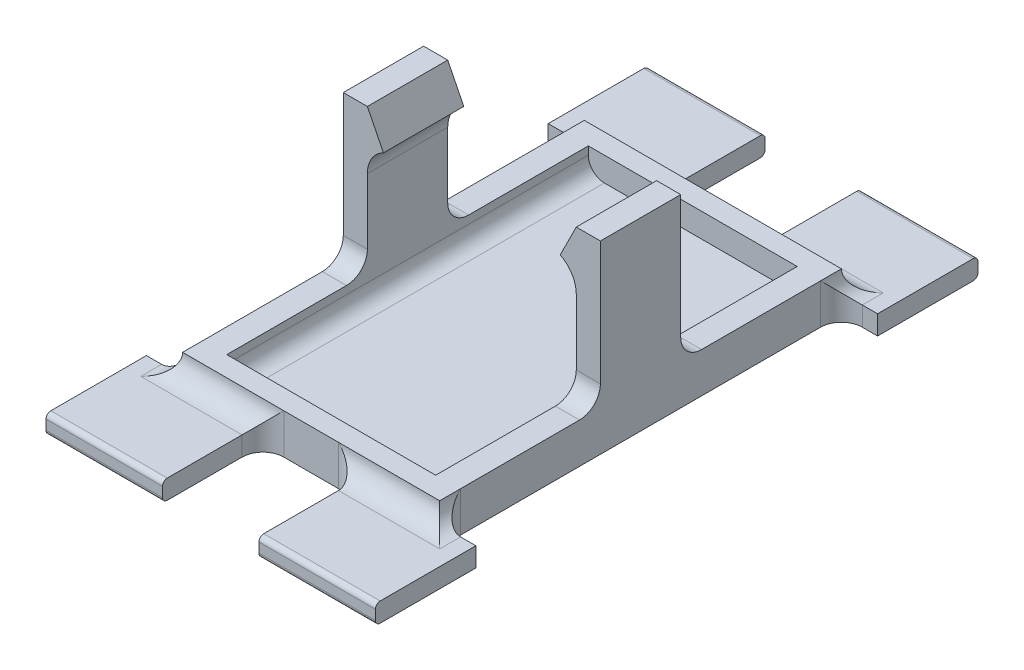
from build123d import *

# Parameters (mm, degrees)
SKETCH1_W                = 32
SKETCH1_H                = 50
BOSS_EXTRUDE1_DEPTH      = 5
CUT_EXTRUDE1_DEPTH       = 22.5
BOSS_EXTRUDE2_DEPTH      = 5
BOSS_EXTRUDE3_DEPTH      = 10
BOSS_EXTRUDE3_DEPTH_BACK = 4.5
BOSS_EXTRUDE3_START      = -16
BOSS_EXTRUDE4_START      = 6
BOSS_EXTRUDE4_DEPTH      = 14.5
FILLET1_R                = 2.6
FILLET2_R                = 2.6


with BuildPart() as part:
    # Sketch1 → Boss-Extrude1 (new body)
    with BuildSketch(Plane(origin=(0, 0, 0), x_dir=(1, 0, 0), z_dir=(0, 1, 0))):
        Rectangle(SKETCH1_W, SKETCH1_H)
    extrude(amount=BOSS_EXTRUDE1_DEPTH)

    # Sketch2 → Cut-Extrude1 (cut, symmetric)
    with BuildSketch(Plane.XY):
        with BuildLine():
            Line((-11, 2), (11, 2))
            ThreePointArc((11, 2), (12.414213562, 2.585786438), (13, 4))
            Line((13, 4), (13, 5))
            Line((13, 5), (-13, 5))
            Line((-13, 5), (-13, 4))
            ThreePointArc((-13, 4), (-12.414213562, 2.585786438), (-11, 2))
        make_face()
    extrude(amount=CUT_EXTRUDE1_DEPTH, both=True, mode=Mode.SUBTRACT)

    # Sketch3 → Boss-Extrude2 (add, symmetric)
    with BuildSketch(Plane.XY):
        with BuildLine():
            Line((-16, 5), (-16, 23))
            Line((-16, 23), (-13, 23))
            Line((-13, 23), (-11, 19))
            ThreePointArc((-11, 19), (-12.459649548, 17.666045055), (-13, 15.763932023))
            Line((-13, 15.763932023), (-13, 5))
            Line((-13, 5), (-16, 5))
        make_face()
        with BuildLine():
            Line((16, 5), (13, 5))
            Line((13, 5), (13, 15.763932023))
            ThreePointArc((13, 15.763932023), (12.459649548, 17.666045055), (11, 19))
            Line((11, 19), (13, 23))
            Line((13, 23), (16, 23))
            Line((16, 23), (16, 5))
        make_face()
    extrude(amount=BOSS_EXTRUDE2_DEPTH, both=True)

    # Sketch4 → Boss-Extrude3 (add, two sides: drawn at the far end of the back side and taken through both)
    with BuildSketch(Plane(origin=(0, 0, 0), x_dir=(0, 0, -1), z_dir=(1, 0, 0)).offset(BOSS_EXTRUDE3_START - BOSS_EXTRUDE3_DEPTH_BACK)):
        with BuildLine():
            Line((25, 0), (36.9, 0))
            ThreePointArc((36.9, 0), (37.324264069, 0.175735931), (37.5, 0.6))
            Line((37.5, 0.6), (37.5, 1.8))
            ThreePointArc((37.5, 1.8), (37.324264069, 2.224264069), (36.9, 2.4))
            Line((36.9, 2.4), (25, 2.4))
            Line((25, 2.4), (25, 0))
        make_face()
        with BuildLine():
            Line((-25, 0), (-36.9, 0))
            ThreePointArc((-36.9, 0), (-37.324264069, 0.175735931), (-37.5, 0.6))
            Line((-37.5, 0.6), (-37.5, 1.8))
            ThreePointArc((-37.5, 1.8), (-37.324264069, 2.224264069), (-36.9, 2.4))
            Line((-36.9, 2.4), (-25, 2.4))
            Line((-25, 2.4), (-25, 0))
        make_face()
    extrude(amount=BOSS_EXTRUDE3_DEPTH + BOSS_EXTRUDE3_DEPTH_BACK)

    # Sketch4<2> → Boss-Extrude4 (add)
    with BuildSketch(Plane(origin=(0, 0, 0), x_dir=(0, 0, -1), z_dir=(1, 0, 0)).offset(BOSS_EXTRUDE4_START)):
        with BuildLine():
            Line((25, 0), (36.9, 0))
            ThreePointArc((36.9, 0), (37.324264069, 0.175735931), (37.5, 0.6))
            Line((37.5, 0.6), (37.5, 1.8))
            ThreePointArc((37.5, 1.8), (37.324264069, 2.224264069), (36.9, 2.4))
            Line((36.9, 2.4), (25, 2.4))
            Line((25, 2.4), (25, 0))
        make_face()
        with BuildLine():
            Line((-25, 0), (-36.9, 0))
            ThreePointArc((-36.9, 0), (-37.324264069, 0.175735931), (-37.5, 0.6))
            Line((-37.5, 0.6), (-37.5, 1.8))
            ThreePointArc((-37.5, 1.8), (-37.324264069, 2.224264069), (-36.9, 2.4))
            Line((-36.9, 2.4), (-25, 2.4))
            Line((-25, 2.4), (-25, 0))
        make_face()
    extrude(amount=BOSS_EXTRUDE4_DEPTH)

    # Fillet1
    fillet1_edges = [part.edges().sort_by_distance(p)[0] for p in [
        (-14.5, 5, 5),
        (14.5, 5, 5),
        (-14.5, 5, -5),
        (14.5, 5, -5),
        (-6, 1.2, -25),
        (6, 1.2, -25),
        (6, 1.2, 25),
        (-6, 1.2, 25),
        (-11, 2.4, -25),
        (11, 2.4, -25),
        (-11, 2.4, 25),
        (11, 2.4, 25),
    ]]
    fillet(fillet1_edges, radius=FILLET1_R - 0.0001)  # a hair under: the kernel refuses the full size

    # Fillet2
    fillet2_edges = [part.edges().sort_by_distance(p)[0] for p in [
        (-16, 2.4, 26.29995),
        (-16, 2.4, -26.29995),
        (-16, 1.2, 25),
        (-16, 1.2, -25),
        (16, 1.2, -25),
        (16, 2.4, -26.29995),
        (16, 2.4, 26.29995),
        (16, 1.2, 25),
    ]]
    fillet(fillet2_edges, radius=FILLET2_R - 0.0004)  # a hair under: the kernel refuses the full size


solid = part.part
